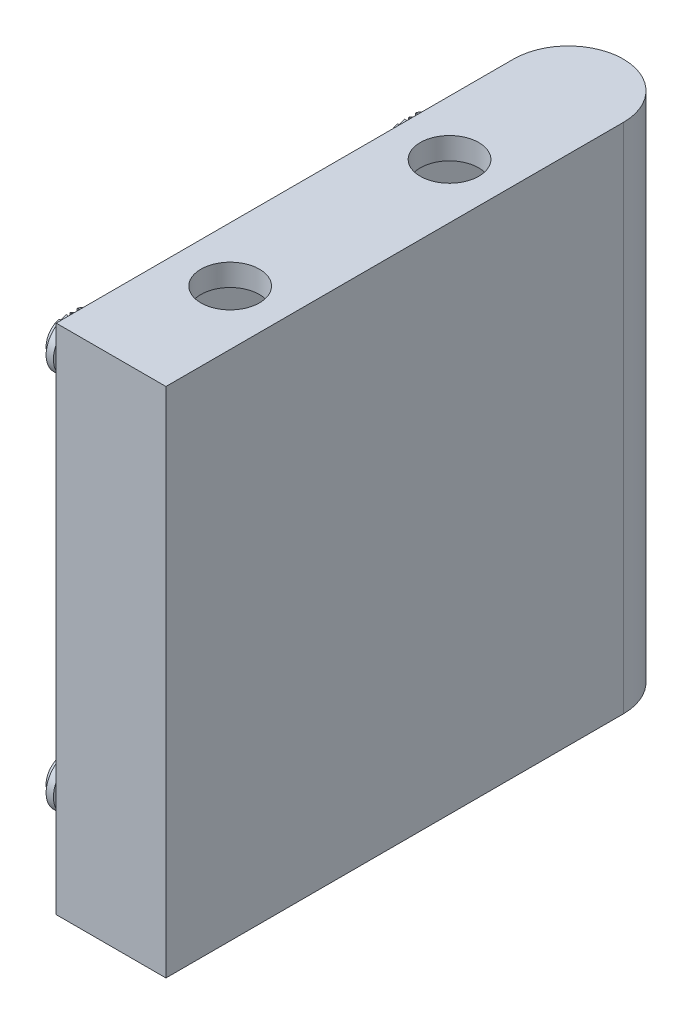
from build123d import *

# Parameters (mm, degrees)
BOSS_EXTRUDE1_DEPTH = 177.8
SHELL1_T            = 7.62
SKETCH3_R           = 10.16
CUT_EXTRUDE2_DEPTH  = 240.117763874
SKETCH4_W           = 76.2
SKETCH4_H           = 85.344
CUT_EXTRUDE3_DEPTH  = 7.62
SKETCH5_R           = 7.62
BOSS_EXTRUDE2_DEPTH = 12.7
SKETCH6_R           = 8.89
BOSS_EXTRUDE3_DEPTH = 5.08
CUT_EXTRUDE4_START  = -17.78
SKETCH19_W          = 3.81
SKETCH19_H          = 20.32
CUT_EXTRUDE4_DEPTH  = 17.78
SKETCH20_R          = 8.89
BOSS_EXTRUDE4_DEPTH = 5.08
CUT_EXTRUDE5_START  = -17.78
SKETCH33_W          = 3.81
SKETCH33_H          = 20.32
CUT_EXTRUDE5_DEPTH  = 17.78
SKETCH34_R          = 8.89
BOSS_EXTRUDE5_DEPTH = 5.08
CUT_EXTRUDE7_START  = -17.78
SKETCH47_W          = 3.81
SKETCH47_H          = 20.32
CUT_EXTRUDE7_DEPTH  = 17.78
SKETCH50_R          = 8.89
BOSS_EXTRUDE6_DEPTH = 5.08
CUT_EXTRUDE8_START  = -17.78
SKETCH63_W          = 3.81
SKETCH63_H          = 20.32
CUT_EXTRUDE8_DEPTH  = 17.78


# Read off the part's stored shape, not the designer's step: Cut-Sweep1, Cut-Sweep2, Cut-Sweep3, Cut-Sweep4
with BuildPart() as part:
    # Sketch2 → Boss-Extrude1 (new body)
    with BuildSketch(Plane(origin=(0, 0, 0), x_dir=(1, 0, 0), z_dir=(0, 1, 0))):
        with BuildLine():
            Line((-19.05, 0), (-19.05, -158.75))
            Line((-19.05, -158.75), (19.05, -158.75))
            Line((19.05, -158.75), (19.05, 0))
            ThreePointArc((19.05, 0), (0, 19.05), (-19.05, 0))
        make_face()
    extrude(amount=BOSS_EXTRUDE1_DEPTH)

    # Shell1 (no face opened: a closed hollow body)
    add(offset(amount=-SHELL1_T, mode=Mode.PRIVATE), mode=Mode.SUBTRACT)

    # Sketch3 → Cut-Extrude2 (cut, through all)
    with BuildSketch(Plane(origin=(0, 0, 0), x_dir=(-1, 0, 0), z_dir=(0, -1, 0))):
        with Locations(Location((0, -41.275, 0), (0, 0, 90))):
            Circle(SKETCH3_R)
        with Locations(Location((0, -117.406107015, 0), (0, 0, 90))):
            Circle(SKETCH3_R)
    extrude(amount=-CUT_EXTRUDE2_DEPTH, mode=Mode.SUBTRACT)

    # Sketch4 → Cut-Extrude3 (cut)
    with BuildSketch(Plane.ZY.offset(19.05)):
        with Locations((79.375, 88.9)):
            Rectangle(SKETCH4_W, SKETCH4_H)
    extrude(amount=-CUT_EXTRUDE3_DEPTH, mode=Mode.SUBTRACT)

    # Sketch5 → Boss-Extrude2 (add)
    with BuildSketch(Plane.ZY.offset(19.05)):
        with Locations(Location((20.6375, 154.686, 0), (0, 0, 180))):
            Circle(SKETCH5_R)
        with Locations(Location((138.1125, 154.686, 0), (0, 0, 180))):
            Circle(SKETCH5_R)
        with Locations(Location((20.6375, 23.114, 0), (0, 0, 180))):
            Circle(SKETCH5_R)
        with Locations(Location((138.1125, 23.114, 0), (0, 0, 180))):
            Circle(SKETCH5_R)
    extrude(amount=BOSS_EXTRUDE2_DEPTH)

    # Sketch6 → Boss-Extrude3 (add)
    with BuildSketch(Plane.ZY.offset(31.75)):
        with Locations((20.6375, 154.686)):
            Circle(SKETCH6_R)
    extrude(amount=BOSS_EXTRUDE3_DEPTH)

    # Cut-Sweep1 outline → Cut-Sweep1 (revolve, cut)
    with BuildSketch(Plane(origin=(0, 154.686, 20.6375), x_dir=(0, 1, 0), z_dir=(0, 0, -1))):
        with BuildLine():
            ThreePointArc((8.89, -34.29), (7.093948776, -35.033948776), (6.35, -36.83))
            Line((6.35, -36.83), (8.89, -36.83))
            Line((8.89, -36.83), (8.89, -34.29))
        make_face()
    revolve(axis=Axis((0, 154.686, 20.6375), (1, 0, 0)), mode=Mode.SUBTRACT)

    # Sketch19 → Cut-Extrude4 (cut)
    with BuildSketch(Plane.ZY.offset(36.83).offset(CUT_EXTRUDE4_START)):
        with Locations((20.6375, 154.686)):
            Rectangle(SKETCH19_W, SKETCH19_H)
    extrude(amount=CUT_EXTRUDE4_DEPTH, mode=Mode.SUBTRACT)

    # Sketch20 → Boss-Extrude4 (add)
    with BuildSketch(Plane.ZY.offset(31.75)):
        with Locations((20.6375, 23.114)):
            Circle(SKETCH20_R)
    extrude(amount=BOSS_EXTRUDE4_DEPTH)

    # Cut-Sweep2 outline → Cut-Sweep2 (revolve, cut)
    with BuildSketch(Plane(origin=(0, 23.114, 20.6375), x_dir=(0, 1, 0), z_dir=(0, 0, -1))):
        with BuildLine():
            ThreePointArc((8.89, -34.29), (7.093948776, -35.033948776), (6.35, -36.83))
            Line((6.35, -36.83), (8.89, -36.83))
            Line((8.89, -36.83), (8.89, -34.29))
        make_face()
    revolve(axis=Axis((0, 23.114, 20.6375), (1, 0, 0)), mode=Mode.SUBTRACT)

    # Sketch33 → Cut-Extrude5 (cut)
    with BuildSketch(Plane.ZY.offset(36.83).offset(CUT_EXTRUDE5_START)):
        with Locations((20.6375, 23.114)):
            Rectangle(SKETCH33_W, SKETCH33_H)
    extrude(amount=CUT_EXTRUDE5_DEPTH, mode=Mode.SUBTRACT)

    # Sketch34 → Boss-Extrude5 (add)
    with BuildSketch(Plane.ZY.offset(31.75)):
        with Locations((138.1125, 154.686)):
            Circle(SKETCH34_R)
    extrude(amount=BOSS_EXTRUDE5_DEPTH)

    # Cut-Sweep3 outline → Cut-Sweep3 (revolve, cut)
    with BuildSketch(Plane(origin=(0, 154.686, 138.1125), x_dir=(0, 1, 0), z_dir=(0, 0, -1))):
        with BuildLine():
            ThreePointArc((8.89, -34.29), (7.093948776, -35.033948776), (6.35, -36.83))
            Line((6.35, -36.83), (8.89, -36.83))
            Line((8.89, -36.83), (8.89, -34.29))
        make_face()
    revolve(axis=Axis((0, 154.686, 138.1125), (1, 0, 0)), mode=Mode.SUBTRACT)

    # Sketch47 → Cut-Extrude7 (cut)
    with BuildSketch(Plane.ZY.offset(36.83).offset(CUT_EXTRUDE7_START)):
        with Locations((138.1125, 154.686)):
            Rectangle(SKETCH47_W, SKETCH47_H)
    extrude(amount=CUT_EXTRUDE7_DEPTH, mode=Mode.SUBTRACT)

    # Sketch50 → Boss-Extrude6 (add)
    with BuildSketch(Plane.ZY.offset(31.75)):
        with Locations((138.1125, 23.114)):
            Circle(SKETCH50_R)
    extrude(amount=BOSS_EXTRUDE6_DEPTH)

    # Cut-Sweep4 outline → Cut-Sweep4 (revolve, cut)
    with BuildSketch(Plane(origin=(0, 23.114, 138.1125), x_dir=(0, 1, 0), z_dir=(0, 0, -1))):
        with BuildLine():
            ThreePointArc((8.89, -34.29), (7.093948776, -35.033948776), (6.35, -36.83))
            Line((6.35, -36.83), (8.89, -36.83))
            Line((8.89, -36.83), (8.89, -34.29))
        make_face()
    revolve(axis=Axis((0, 23.114, 138.1125), (1, 0, 0)), mode=Mode.SUBTRACT)

    # Sketch63 → Cut-Extrude8 (cut)
    with BuildSketch(Plane.ZY.offset(36.83).offset(CUT_EXTRUDE8_START)):
        with Locations((138.1125, 23.114)):
            Rectangle(SKETCH63_W, SKETCH63_H)
    extrude(amount=CUT_EXTRUDE8_DEPTH, mode=Mode.SUBTRACT)


solid = part.part
